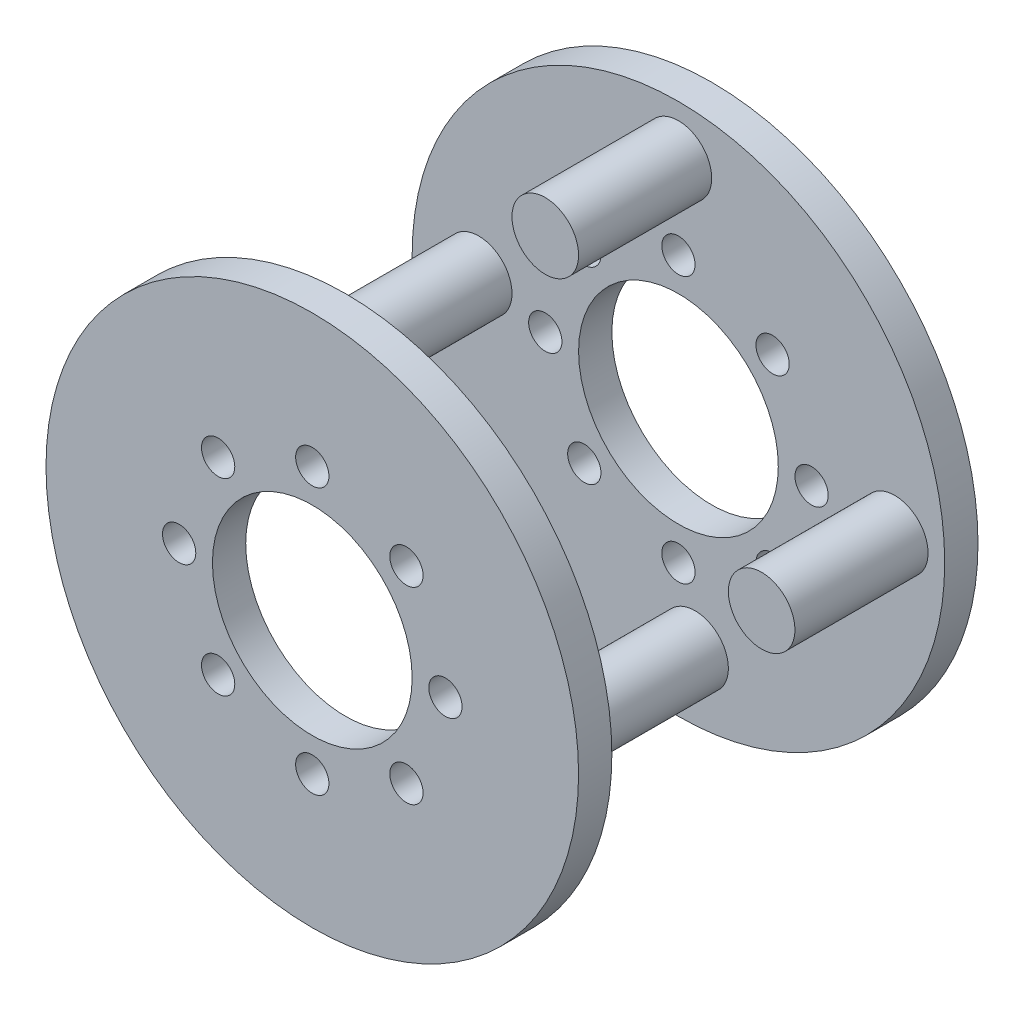
from build123d import *

# Parameters (mm, degrees)
ESQUISSE1_R                  = 80
BOSS_EXTRU_1_DEPTH           = 10
ESQUISSE2_R                  = 30
ENL_V_MAT_EXTRU_1_DEPTH      = 10
ESQUISSE3_R                  = 5
ENL_V_MAT_EXTRU_2_DEPTH      = 10
R_P_TITION_CIRCULAIRE1_COUNT = 8
ESQUISSE4_R                  = 10
BOSS_EXTRU_2_DEPTH           = 40
R_P_TITION_CIRCULAIRE2_COUNT = 4


with BuildPart() as part:
    # Esquisse1 → Boss.-Extru.1 (new body)
    with BuildSketch(Plane(origin=(0, 0, -50), x_dir=(-1, 0, 0), z_dir=(0, 0, -1))):
        Circle(ESQUISSE1_R)
    extrude(amount=BOSS_EXTRU_1_DEPTH)

    # Esquisse2 → Enlèv. mat.-Extru.1 (cut)
    with BuildSketch(Plane.XY.offset(-50)):
        Circle(ESQUISSE2_R)
    extrude(amount=-ENL_V_MAT_EXTRU_1_DEPTH, mode=Mode.SUBTRACT)

    # Esquisse3 → Enlèv. mat.-Extru.2 (cut)
    with BuildSketch(Plane.XY.offset(-50)):
        with Locations((0, 40)):
            Circle(ESQUISSE3_R)
    enl_v_mat_extru_2 = extrude(amount=-ENL_V_MAT_EXTRU_2_DEPTH, mode=Mode.SUBTRACT)

    # Répétition circulaire1: Enlèv. mat.-Extru.2 ×8 about axis
    r_p_tition_circulaire1_axis = Axis((0, 0, -50), (0, 0, -1))
    for i in range(1, R_P_TITION_CIRCULAIRE1_COUNT):
        add(enl_v_mat_extru_2.rotate(r_p_tition_circulaire1_axis, i * 360 / R_P_TITION_CIRCULAIRE1_COUNT), mode=Mode.SUBTRACT)

    # Esquisse4 → Boss.-Extru.2 (add)
    with BuildSketch(Plane.XY.offset(-50)):
        with Locations((0, 65)):
            Circle(ESQUISSE4_R)
    boss_extru_2 = extrude(amount=BOSS_EXTRU_2_DEPTH)

    # Répétition circulaire2: Boss.-Extru.2 ×4 about axis
    r_p_tition_circulaire2_axis = Axis((0, 0, -50), (0, 0, -1))
    for i in range(1, R_P_TITION_CIRCULAIRE2_COUNT):
        add(boss_extru_2.rotate(r_p_tition_circulaire2_axis, i * 360 / R_P_TITION_CIRCULAIRE2_COUNT))


with BuildPart() as body_2:
    # Symétrie3: mirrored copy
    add(part.part.mirror(Plane.XY))


solid = Compound([part.part, body_2.part])
